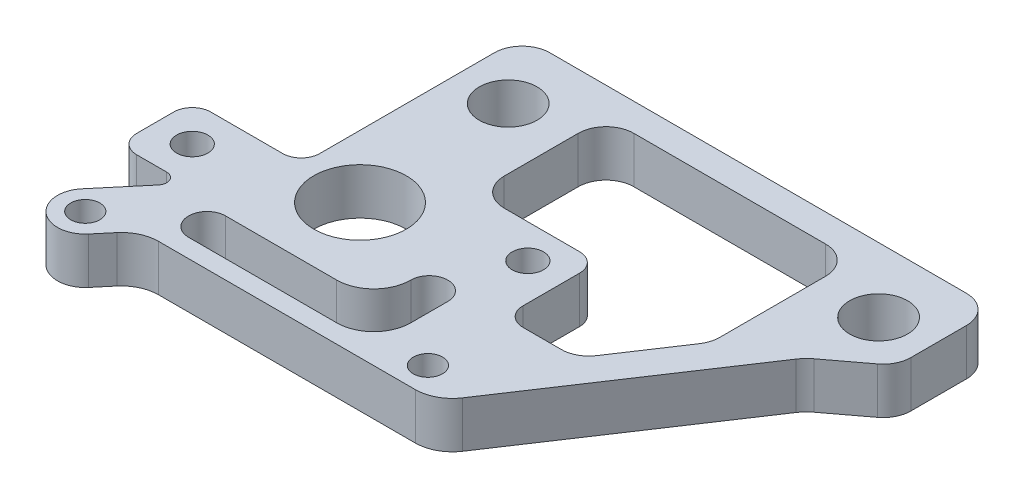
from build123d import *

# Parameters (mm, degrees)
SKETCH4_R           = 2
SKETCH4_R_2         = 3.96875
BOSS_EXTRUDE2_DEPTH = 6.35
FILLET1_R           = 5.08
FILLET7_R           = 3.81
FILLET9_R           = 5.08
FILLET10_R          = 1.27
FILLET11_R          = 3.81
FILLET12_R          = 2.54
FILLET13_R          = 3.81


with BuildPart() as part:
    # Sketch4 → Boss-Extrude2 (new body)
    with BuildSketch(Plane(origin=(0, 0, 0), x_dir=(1, 0, 0), z_dir=(0, 1, 0))):
        with BuildLine():
            Line((22.483900583, -18.4375), (28.735494078, -18.4375))
            Line((28.735494078, -18.4375), (48.985566477, 12.027918285))
            Line((48.985566477, 12.027918285), (54.680415238, 16.319294633))
            ThreePointArc((54.680415238, 16.319294633), (55.797199918, 17.662082259), (56.1975, 19.362095927))
            Line((56.1975, 19.362095927), (56.1975, 26.9875))
            ThreePointArc((56.1975, 26.9875), (55.081576836, 29.681576836), (52.3875, 30.7975))
            Line((52.3875, 30.7975), (-4.7625, 30.7975))
            ThreePointArc((-4.7625, 30.7975), (-7.456576836, 29.681576836), (-8.5725, 26.9875))
            Line((-8.5725, 26.9875), (-8.5725, 12.607500122))
            Line((-8.5725, 12.607500122), (-8.5725, 0.508))
            Line((-8.5725, 0.508), (-23.52171402, 0.508))
            Line((-23.52171402, 0.508), (-23.52171402, -9.652))
            Line((-23.52171402, -9.652), (-14.139296969, -9.652))
            Line((-14.139296969, -9.652), (-23.148009155, -20.371437257))
            Line((-23.148009155, -20.371437257), (-17.314513469, -25.273959881))
            Line((-17.314513469, -25.273959881), (-11.569090649, -18.4375))
            Line((-11.569090649, -18.4375), (22.483900583, -18.4375))
        make_face()
        with Locations(Location((-17.78, -19.905950726, 0), (0, 0, 270))):
            Circle(SKETCH4_R, mode=Mode.SUBTRACT)
        with BuildLine():
            ThreePointArc((-16.29541402, -4.572), (-20.572189245, -4.832151892), (-16.358479767, -4.055532442))
            ThreePointArc((-16.358479767, -4.055532442), (-16.311238795, -4.311848108), (-16.29541402, -4.572))
        make_face(mode=Mode.SUBTRACT)
        with BuildLine():
            ThreePointArc((-7.62, -15.8975), (-10.16, -13.3575), (-7.62, -10.8175))
            Line((-7.62, -10.8175), (12.7, -10.8175))
            Line((12.7, -10.8175), (12.7, -5.7375))
            ThreePointArc((12.7, -5.7375), (15.24, -3.1975), (17.78, -5.7375))
            Line((17.78, -5.7375), (17.78, -13.3575))
            Line((17.78, -13.3575), (17.78, -15.8975))
            Line((17.78, -15.8975), (15.24, -15.8975))
            Line((15.24, -15.8975), (-7.62, -15.8975))
        make_face(mode=Mode.SUBTRACT)
        with BuildLine():
            ThreePointArc((-6.163414949, -1.528010526), (-1.528010526, 6.163414949), (6.163414949, 1.528010526))
            ThreePointArc((6.163414949, 1.528010526), (6.303181138, 0.769680153), (6.35, 0))
            ThreePointArc((6.35, 0), (0.769680153, -6.303181138), (-6.163414949, -1.528010526))
        make_face(mode=Mode.SUBTRACT)
        with Locations(Location((24.012521227, -14.703599027, 0), (0, 0, 270))):
            Circle(SKETCH4_R, mode=Mode.SUBTRACT)
        with Locations(Location((-1.5875, 21.9075, 0), (0, 0, 270))):
            Circle(SKETCH4_R_2, mode=Mode.SUBTRACT)
        with BuildLine():
            ThreePointArc((20.58801402, 4.572), (18.701865912, 2.441524775), (16.358479767, 4.055532442))
            ThreePointArc((16.358479767, 4.055532442), (18.181562129, 6.702475225), (20.58801402, 4.572))
        make_face(mode=Mode.SUBTRACT)
        Polygon((6.749565973, 9.2075), (6.749565973, 26.9875), (40.692955064, 26.9875), (40.692955064, 7.472580753), (33.28904903, -3.666297657), (23.452955064, -3.666297657), (23.452955064, 9.2075), align=None, mode=Mode.SUBTRACT)
        with Locations(Location((49.2125, 21.9075, 0), (0, 0, 270))):
            Circle(SKETCH4_R_2, mode=Mode.SUBTRACT)
    extrude(amount=-BOSS_EXTRUDE2_DEPTH)

    # Fillet1
    fillet1_edges = [part.edges().sort_by_distance(p)[0] for p in [
        (48.985566477, -3.175, -12.027918285),
        (28.735494078, -3.175, 18.4375),
    ]]
    fillet(fillet1_edges, radius=FILLET1_R)

    # Fillet7
    fillet7_edges = [part.edges().sort_by_distance(p)[0] for p in [
        (40.692955064, -3.175, -7.472580753),
        (40.692955064, -3.175, -26.9875),
        (6.749565973, -3.175, -26.9875),
        (6.749565973, -3.175, -9.2075),
    ]]
    fillet(fillet7_edges, radius=FILLET7_R)

    # Fillet9
    fillet9_edges = [part.edges().sort_by_distance(p)[0] for p in [
        (-11.569090649, -3.175, 18.4375),
        (12.7, -3.175, 10.8175),
        (17.78, -3.175, 15.8975),
    ]]
    fillet(fillet9_edges, radius=FILLET9_R - 0.0001)  # a hair under: the kernel refuses the full size

    # Fillet10
    fillet10_edges = [part.edges().sort_by_distance(p)[0] for p in [
        (-14.139296969, -3.175, 9.652),
    ]]
    fillet(fillet10_edges, radius=FILLET10_R)

    # Fillet11
    fillet11_edges = [part.edges().sort_by_distance(p)[0] for p in [
        (-17.314513469, -3.175, 25.273959881),
        (-23.148009155, -3.175, 20.371437257),
    ]]
    fillet(fillet11_edges, radius=FILLET11_R - 0.0001)  # a hair under: the kernel refuses the full size

    # Fillet12
    fillet12_edges = [part.edges().sort_by_distance(p)[0] for p in [
        (23.452955064, -3.175, -9.2075),
        (23.452955064, -3.175, 3.666297657),
        (-23.52171402, -3.175, 9.652),
        (-23.52171402, -3.175, -0.508),
        (-8.5725, -3.175, -0.508),
    ]]
    fillet(fillet12_edges, radius=FILLET12_R)

    # Fillet13
    fillet13_edges = [part.edges().sort_by_distance(p)[0] for p in [
        (33.28904903, -3.175, 3.666297657),
    ]]
    fillet(fillet13_edges, radius=FILLET13_R)


solid = part.part
